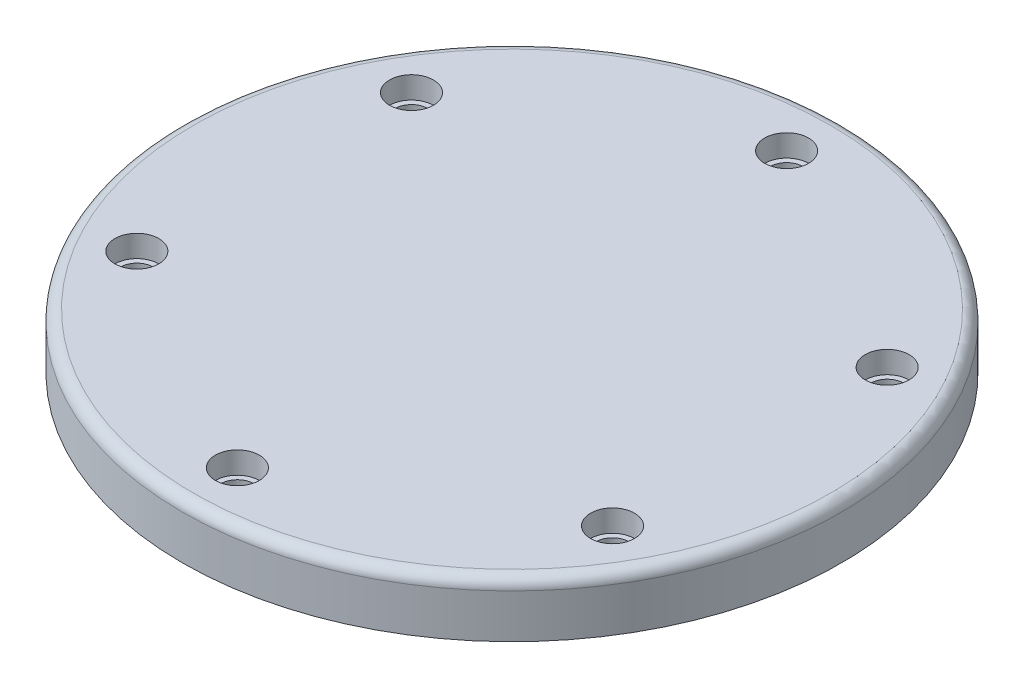
from build123d import *

# Parameters (mm, degrees)
PATTERN_CIRCULAR_1_OUTLINE_R     = 1.5
PATTERN_CIRCULAR_1_DEPTH         = 5
PATTERN_START                    = 3
PATTERN_CIRCULAR_1_2_OUTLINE_R   = 2
PATTERN_CIRCULAR_1_2_OUTLINE_R_2 = 1.5
PATTERN_CIRCULAR_1_2_DEPTH       = 2


# Read off the part's stored shape, not the designer's step: Круговой массив1
with BuildPart() as part:
    # Эскиз1 → Повернуть1 (revolve)
    with BuildSketch(Plane(origin=(0, 0, 0), x_dir=(0, 0, -1), z_dir=(1, 0, 0))):
        with BuildLine():
            Line((0, 0), (30, 0))
            Line((30, 0), (30, 4))
            ThreePointArc((30, 4), (29.707106781, 4.707106781), (29, 5))
            Line((29, 5), (0, 5))
            Line((0, 5), (0, 0))
        make_face()
    revolve(axis=Axis((0, 0, 0), (0, 1, 0)))

    # Эскиз2 → Вырез-Повернуть1 (revolve, cut)
    with BuildSketch(Plane(origin=(0, 0, 0), x_dir=(0, 0, -1), z_dir=(1, 0, 0))):
        Polygon((-25, 0), (-23.5, 0), (-23.5, 3), (-23, 3), (-23, 5), (-25, 5), align=None)
    revolve(axis=Axis((0, 0, 25), (0, 1, 0)), mode=Mode.SUBTRACT)

    # Круговой массив1 outline → Круговой массив1 (cut)
    with BuildSketch(Plane(origin=(0, 0, 0), x_dir=(1, 0, 0), z_dir=(0, 1, 0))):
        with Locations((-21.650635095, -12.5)):
            Circle(PATTERN_CIRCULAR_1_OUTLINE_R)
        with Locations((-21.650635095, 12.5)):
            Circle(PATTERN_CIRCULAR_1_OUTLINE_R)
        with Locations((0, 25)):
            Circle(PATTERN_CIRCULAR_1_OUTLINE_R)
        with Locations((21.650635095, 12.5)):
            Circle(PATTERN_CIRCULAR_1_OUTLINE_R)
        with Locations((21.650635095, -12.5)):
            Circle(PATTERN_CIRCULAR_1_OUTLINE_R)
    extrude(amount=PATTERN_CIRCULAR_1_DEPTH, mode=Mode.SUBTRACT)

    # Pattern Circular 1 2 outline → Pattern Circular 1 2 (cut)
    # profile 1 of 5: a face of its own
    with BuildSketch(Plane(origin=(0, 0, 0), x_dir=(1, 0, 0), z_dir=(0, 1, 0)).offset(PATTERN_START)):
        with Locations((-21.650635095, -12.5)):
            Circle(PATTERN_CIRCULAR_1_2_OUTLINE_R)
        with Locations((-21.650635095, -12.5)):
            Circle(PATTERN_CIRCULAR_1_2_OUTLINE_R_2, mode=Mode.SUBTRACT)
    # profile 2 of 5: a face of its own
    with BuildSketch(Plane(origin=(0, 0, 0), x_dir=(1, 0, 0), z_dir=(0, 1, 0)).offset(PATTERN_START)):
        with Locations((-21.650635095, 12.5)):
            Circle(PATTERN_CIRCULAR_1_2_OUTLINE_R)
        with Locations((-21.650635095, 12.5)):
            Circle(PATTERN_CIRCULAR_1_2_OUTLINE_R_2, mode=Mode.SUBTRACT)
    # profile 3 of 5: a face of its own
    with BuildSketch(Plane(origin=(0, 0, 0), x_dir=(1, 0, 0), z_dir=(0, 1, 0)).offset(PATTERN_START)):
        with Locations((0, 25)):
            Circle(PATTERN_CIRCULAR_1_2_OUTLINE_R)
        with Locations((0, 25)):
            Circle(PATTERN_CIRCULAR_1_2_OUTLINE_R_2, mode=Mode.SUBTRACT)
    # profile 4 of 5: a face of its own
    with BuildSketch(Plane(origin=(0, 0, 0), x_dir=(1, 0, 0), z_dir=(0, 1, 0)).offset(PATTERN_START)):
        with Locations((21.650635095, 12.5)):
            Circle(PATTERN_CIRCULAR_1_2_OUTLINE_R)
        with Locations((21.650635095, 12.5)):
            Circle(PATTERN_CIRCULAR_1_2_OUTLINE_R_2, mode=Mode.SUBTRACT)
    # profile 5 of 5: a face of its own
    with BuildSketch(Plane(origin=(0, 0, 0), x_dir=(1, 0, 0), z_dir=(0, 1, 0)).offset(PATTERN_START)):
        with Locations((21.650635095, -12.5)):
            Circle(PATTERN_CIRCULAR_1_2_OUTLINE_R)
        with Locations((21.650635095, -12.5)):
            Circle(PATTERN_CIRCULAR_1_2_OUTLINE_R_2, mode=Mode.SUBTRACT)
    extrude(amount=PATTERN_CIRCULAR_1_2_DEPTH, mode=Mode.SUBTRACT)


solid = part.part
